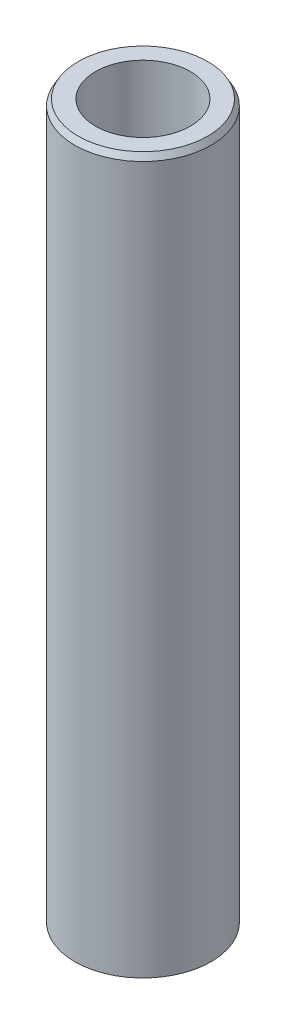
from build123d import *
from OCP.BRepFilletAPI import BRepFilletAPI_MakeChamfer

# Parameters (mm, degrees)
SKETCH1_R           = 10
BOSS_EXTRUDE1_DEPTH = 105.042365516
SKETCH2_R           = 6.947782313
CUT_EXTRUDE1_DEPTH  = 106.990087051
CHAMFER1_SIZE       = 0.888021207
CHAMFER1_SIZE2      = 0.512699283


with BuildPart() as part:
    # Sketch1 → Boss-Extrude1 (new body)
    with BuildSketch(Plane(origin=(0, 0, 0), x_dir=(1, 0, 0), z_dir=(0, 1, 0))):
        Circle(SKETCH1_R)
    extrude(amount=BOSS_EXTRUDE1_DEPTH)

    # Sketch2 → Cut-Extrude1 (cut, through all)
    with BuildSketch(Plane(origin=(0, 0, 0), x_dir=(1, 0, 0), z_dir=(0, 1, 0))):
        Circle(SKETCH2_R)
    extrude(amount=CUT_EXTRUDE1_DEPTH, mode=Mode.SUBTRACT)

    # Chamfer1: one chamfer whose edges measure the first distance from different faces: ONE call of the kernel's chamfer builder (chamfer() names one face for all edges)
    chamfer1_edges_1 = [part.edges().sort_by_distance(p)[0] for p in [
        (-10, 105.042365516, 0),
    ]]
    chamfer1_side_1 = [part.faces().sort_by_distance(p)[0] for p in [
        (-10, 52.521182758, 0),
    ]]
    chamfer1_edges_2 = [part.edges().sort_by_distance(p)[0] for p in [
        (-10, 0, 0),
    ]]
    chamfer1_side_2 = [part.faces().sort_by_distance(p)[0] for p in [
        (-9.717157288, 0, 0),
    ]]
    chamfer1 = BRepFilletAPI_MakeChamfer(part.part.solid().wrapped)
    for e in chamfer1_edges_1:
        chamfer1.Add(CHAMFER1_SIZE, CHAMFER1_SIZE2, e.wrapped, chamfer1_side_1[0].wrapped)  # the first distance lies on this face
    for e in chamfer1_edges_2:
        chamfer1.Add(CHAMFER1_SIZE, CHAMFER1_SIZE2, e.wrapped, chamfer1_side_2[0].wrapped)  # the first distance lies on this face
    add(Compound.cast(chamfer1.Shape()), mode=Mode.REPLACE)


solid = part.part
